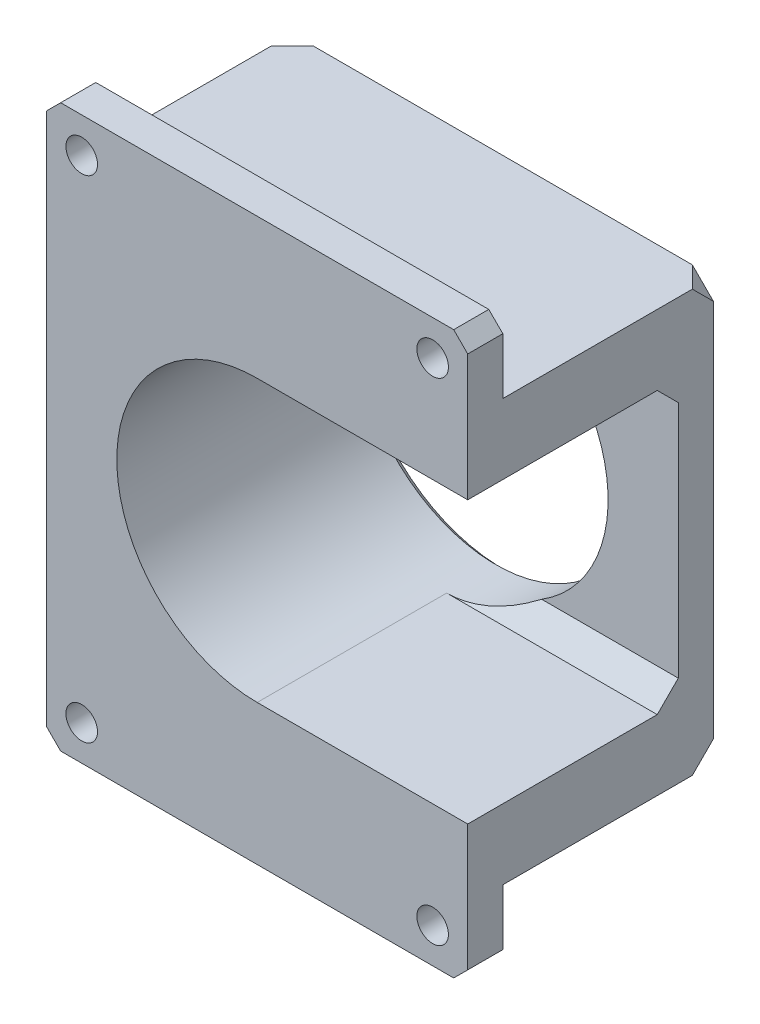
from build123d import *

# Parameters (mm, degrees)
BOSS_EXTRUDE1_DEPTH                                  = 35
CUT_EXTRUDE1_DEPTH                                   = 30
SKETCH3_R                                            = 20.000000000000007
CUT_EXTRUDE2_DEPTH                                   = 52.96152422706633
M4_TAPPED_HOLE1_D                                    = 3.3
M4_TAPPED_HOLE1_DEPTH                                = 10.1
M4_TAPPED_HOLE1_TIP                                  = 0.9914200213954745
BOSS_EXTRUDE2_DEPTH                                  = 5
CBORE_FOR_M4_HEXAGON_SOCKET_HEAD_CAP_SCR_D           = 4.5
CBORE_FOR_M4_HEXAGON_SOCKET_HEAD_CAP_SCR_CBORE_D     = 8
CBORE_FOR_M4_HEXAGON_SOCKET_HEAD_CAP_SCR_CBORE_DEPTH = 1
CHAMFER1_SIZE                                        = 2
CHAMFER2_START                                       = 32.908965344
CHAMFER2_OUTLINE_W                                   = 7.000000000000002
CHAMFER2_OUTLINE_H                                   = 7.0000000000000036
CHAMFER2_DEPTH                                       = 3.091034656
MIRROR1_START                                        = 32.908965344
MIRROR1_AT_THE_SECOND_PLANE_COPY_1_SKETC_W           = 7.000000000000002
MIRROR1_AT_THE_SECOND_PLANE_COPY_1_SKETC_H           = 7.0000000000000036
MIRROR1_AT_THE_SECOND_PLANE_COPY_1_DEPTH             = 3.091034656
CHAMFER3_SIZE                                        = 1
CHAMFER4_SIZE                                        = 3


with BuildPart() as part:
    # Sketch1 → Boss-Extrude1 (new body)
    with BuildSketch(Plane.XY):
        Polygon((-29.999999999999993, 30), (30, 30), (30.000000000000014, -30), (-29.999999999999986, -30), align=None)
    extrude(amount=BOSS_EXTRUDE1_DEPTH)

    # Sketch2 → Cut-Extrude1 (cut)
    with BuildSketch(Plane.XY.offset(35)):
        with BuildLine():
            Line((0, 20.000000000000004), (30.00000000000001, 20.000000000000004))
            Line((30.00000000000001, 20.000000000000004), (30, -20.000000000000004))
            Line((30, -20.000000000000004), (0, -20.000000000000004))
            ThreePointArc((0, -20.000000000000004), (-20.000000000000004, 2.45e-15), (0, 20.000000000000004))
        make_face()
    extrude(amount=-CUT_EXTRUDE1_DEPTH, mode=Mode.SUBTRACT)

    # Sketch3 → Cut-Extrude2 (cut, through all)
    with BuildSketch(Plane.XY.offset(5.000000000000004)):
        Circle(SKETCH3_R)
    extrude(amount=-CUT_EXTRUDE2_DEPTH, mode=Mode.SUBTRACT)

    # M4 Tapped Hole1
    with Locations(Plane(origin=(0, 0, 0), x_dir=(-1, 0, 0), z_dir=(0, 0, -1))):
        with Locations((-25, 25), (25, 25), (25, -25), (-25, -25)):
            Hole(M4_TAPPED_HOLE1_D / 2, depth=M4_TAPPED_HOLE1_DEPTH)
            with Locations((0, 0, -(M4_TAPPED_HOLE1_DEPTH + M4_TAPPED_HOLE1_TIP / 2))):  # 118° drill point
                Cone(0, M4_TAPPED_HOLE1_D / 2, M4_TAPPED_HOLE1_TIP, mode=Mode.SUBTRACT)

    # Sketch7 → Boss-Extrude2 (add)
    with BuildSketch(Plane.XY.offset(35)):
        Polygon((-29.999999999999993, 30), (30, 29.999999999999993), (30, 40), (-29.999999999999993, 40), align=None)
        Polygon((30, -29.999999999999993), (30, -40), (-29.999999999999993, -40), (-29.999999999999993, -30), align=None)
    extrude(amount=-BOSS_EXTRUDE2_DEPTH)

    # CBORE for M4 Hexagon socket head cap screws1 (through all)
    with Locations(Plane(origin=(0, 0, 30.000000000000004), x_dir=(-1, 0, 0), z_dir=(0, 0, -1))):
        with Locations((-25, 35), (-25, -35), (25, -35), (25, 35)):
            CounterBoreHole(CBORE_FOR_M4_HEXAGON_SOCKET_HEAD_CAP_SCR_D / 2, CBORE_FOR_M4_HEXAGON_SOCKET_HEAD_CAP_SCR_CBORE_D / 2, CBORE_FOR_M4_HEXAGON_SOCKET_HEAD_CAP_SCR_CBORE_DEPTH)

    # Chamfer1
    chamfer1_edges = [part.edges().sort_by_distance(p)[0] for p in [
        (-29.999999999999993, 40, 32.5),
        (30, 40, 32.5),
        (30, -40, 32.5),
        (-29.999999999999993, -40, 32.5),
    ]]
    chamfer(chamfer1_edges, length=CHAMFER1_SIZE)

    # Chamfer2: read off the stored shape, not the designer's step
    # Chamfer2 outline → Chamfer2 (cut)
    with BuildSketch(Plane(origin=(0, 0, 0), x_dir=(0.8164965809277258, -0.40824829046386313, 0.40824829046386313), z_dir=(0.5773502691896258, 0.5773502691896258, -0.5773502691896258)).offset(CHAMFER2_START)):
        with Locations((11.5, -21.5)):
            Rectangle(CHAMFER2_OUTLINE_W, CHAMFER2_OUTLINE_H)
    chamfer2 = extrude(amount=CHAMFER2_DEPTH, mode=Mode.SUBTRACT)

    # Mirror1: Chamfer2 across plane
    add(chamfer2.mirror(Plane(origin=(0, 0, 0), x_dir=(0, 0, 1), z_dir=(1, 0, 0))), mode=Mode.SUBTRACT)

    # Mirror1 at the second plane: Chamfer2 across plane
    add(chamfer2.mirror(Plane.ZX), mode=Mode.SUBTRACT)

    # Mirror1 at the second plane copy 1 sketc → Mirror1 at the second plane copy 1 (cut)
    with BuildSketch(Plane(origin=(0, 0, 0), x_dir=(-0.8164965809277258, 0.40824829046386313, 0.40824829046386313), z_dir=(-0.5773502691896258, -0.5773502691896258, -0.5773502691896258)).offset(MIRROR1_START)):
        with Locations((11.5, -21.5)):
            Rectangle(MIRROR1_AT_THE_SECOND_PLANE_COPY_1_SKETC_W, MIRROR1_AT_THE_SECOND_PLANE_COPY_1_SKETC_H)
    extrude(amount=MIRROR1_AT_THE_SECOND_PLANE_COPY_1_DEPTH, mode=Mode.SUBTRACT)

    # Chamfer3
    chamfer3_edges = [part.edges().sort_by_distance(p)[0] for p in [
        (-20.000000000000007, 2.45e-15, 0),
    ]]
    chamfer(chamfer3_edges, length=CHAMFER3_SIZE)

    # Chamfer4
    # the kernel refuses this chamfer: 3 mm, written as the material it adds along each edge
    with BuildSketch(Plane(origin=(-13.115583238626146, 20.000000000000004, 5), x_dir=(0, -1, 0), z_dir=(1, 0, 0))) as chamfer4_piece_1_section:
        Polygon((CHAMFER4_SIZE, 0), (0, -CHAMFER4_SIZE), (0, 0), align=None)
    chamfer4_piece_1 = extrude(amount=43.11558323862616, mode=Mode.PRIVATE)
    chamfer4_piece_1 = chamfer4_piece_1 - Plane(origin=(0, 0, 5), x_dir=(1, 0, 0), z_dir=(0, 0, 1)) * Cylinder(20.000000000000007, 99, mode=Mode.PRIVATE)
    add(chamfer4_piece_1)
    with BuildSketch(Plane(origin=(30, -20.000000000000004, 5), x_dir=(0, 0, 1), z_dir=(-1, 0, 0))) as chamfer4_piece_2_section:
        Polygon((CHAMFER4_SIZE, 0), (0, CHAMFER4_SIZE), (0, 0), align=None)
    chamfer4_piece_2 = extrude(amount=43.11558323862615, mode=Mode.PRIVATE)
    chamfer4_piece_2 = chamfer4_piece_2 - Plane(origin=(0, 0, 5), x_dir=(1, 0, 0), z_dir=(0, 0, 1)) * Cylinder(20.000000000000007, 99, mode=Mode.PRIVATE)
    add(chamfer4_piece_2)


solid = part.part
